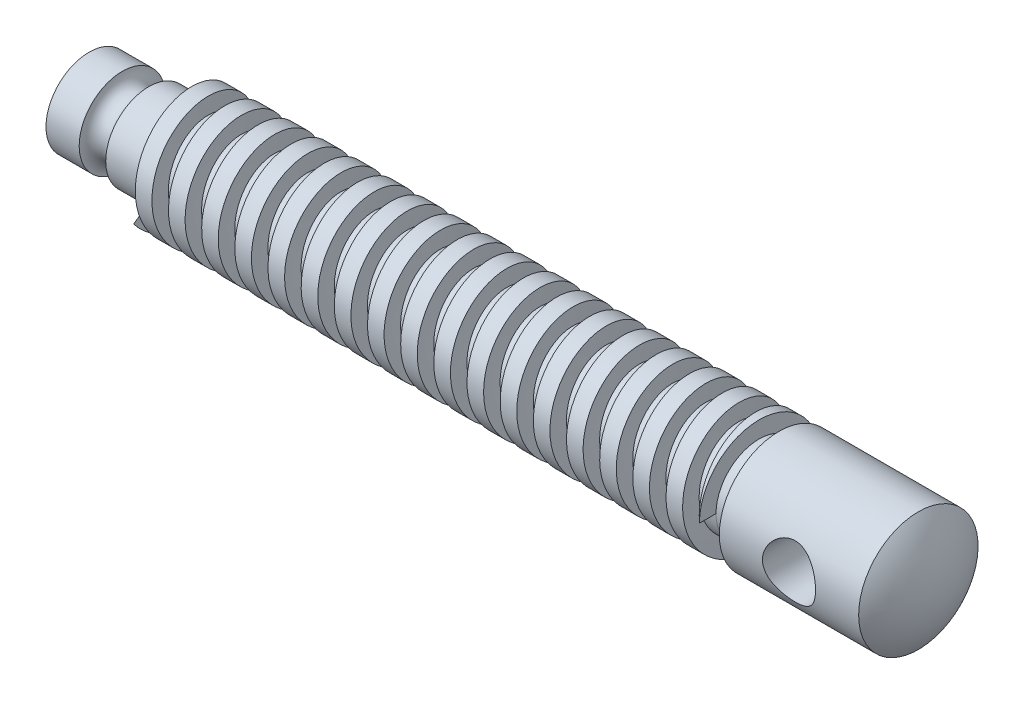
from build123d import *

# Parameters (mm, degrees)
CORTE_EXTRUS_O1_DEPTH      = 10
CORTE_EXTRUS_O1_DEPTH_BACK = 10
ESBO_O2_R                  = 4
VARREDURA_DE_CORTE1_PITCH  = 5
VARREDURA_DE_CORTE1_FROM   = 0


with BuildPart() as part:
    # Esboço1 → Revolução1 (revolve)
    with BuildSketch(Plane.XY, mode=Mode.PRIVATE) as revolu_o1_sk:
        with BuildLine():
            Line((-57.734372102, 0), (-53.734372102, 6.5))
            Line((-53.734372102, 6.5), (-48.734372102, 6.5))
            ThreePointArc((-48.734372102, 6.5), (-46.734372102, 4.5), (-44.734372102, 6.5))
            Line((-44.734372102, 6.5), (-39.734372102, 6.5))
            Line((-39.734372102, 6.5), (-39.734372102, 9))
            Line((-39.734372102, 9), (47.265627898, 9))
            Line((47.265627898, 9), (47.265627898, 6.5))
            Line((47.265627898, 6.5), (50.265627898, 6.5))
            Line((50.265627898, 6.5), (50.265627898, 9))
            Line((50.265627898, 9), (71.265627898, 9))
            ThreePointArc((71.265627898, 9), (73.495877369, 4.74341649), (74.265627898, 0))
            Line((74.265627898, 0), (-57.734372102, 0))
        make_face()
    revolve(revolu_o1_sk.sketch.rotate(Axis((-60.912149879, 0, 0), (1, 0, 0)), 90), axis=Axis((-60.912149879, 0, 0), (1, 0, 0)))

    # Esboço2 → Corte-extrusão1 (cut, two sides: drawn at the far end of the back side and taken through both)
    with BuildSketch(Plane.XY.offset(-CORTE_EXTRUS_O1_DEPTH_BACK)):
        with Locations(Location((60.765627898, 0, 0), (0, 0, 180))):
            Circle(ESBO_O2_R)
    extrude(amount=CORTE_EXTRUS_O1_DEPTH + CORTE_EXTRUS_O1_DEPTH_BACK, mode=Mode.SUBTRACT)

    # Varredura de corte1: arcs per turn and ends read off the stored shape
    # Varredura de corte1: the profile of Esboço4 profile screwed along a right-hand helix through 19 turns, 12 arcs to a turn; built about Z, then put on its axis
    varredura_de_corte1_z = Axis((0, 0, 0), (0, 0, 1))
    varredura_de_corte1_corners = [(9, 0, -5), (6.4997, 0, -5), (6.4997, 0, -2.5), (9, 0, -2.5)]
    with BuildLine(mode=Mode.PRIVATE) as varredura_de_corte1_profile:
        Line(varredura_de_corte1_corners[0], varredura_de_corte1_corners[1])
        Line(varredura_de_corte1_corners[1], varredura_de_corte1_corners[2])
        Line(varredura_de_corte1_corners[2], varredura_de_corte1_corners[3])
        Line(varredura_de_corte1_corners[3], varredura_de_corte1_corners[0])
    varredura_de_corte1_cap = Face(varredura_de_corte1_profile.wire())
    varredura_de_corte1_turn_angles = [0, 15, 30, 45, 60, 75, 90, 105, 120, 135, 150, 165, 180, 195, 210, 225, 240, 255, 270, 285, 300, 315, 330, 345, 360]
    varredura_de_corte1_turn_weights = [1, 0.9659258262890683, 1, 0.9659258262890683, 1, 0.9659258262890683, 1, 0.9659258262890683, 1, 0.9659258262890683, 1, 0.9659258262890683, 1, 0.9659258262890683, 1, 0.9659258262890683, 1, 0.9659258262890683, 1, 0.9659258262890683, 1, 0.9659258262890683, 1, 0.9659258262890683, 1]
    varredura_de_corte1_turn_rails = [Edge.make_bspline([Vector(p[0], p[1], 0).rotate(varredura_de_corte1_z, varredura_de_corte1_turn_angles[k]) / varredura_de_corte1_turn_weights[k] + Vector(0, 0, p[2] + VARREDURA_DE_CORTE1_PITCH * varredura_de_corte1_turn_angles[k] / 360) for k in range(25)], [0, 0, 0, 1, 1, 2, 2, 3, 3, 4, 4, 5, 5, 6, 6, 7, 7, 8, 8, 9, 9, 10, 10, 11, 11, 12, 12, 12], 2, varredura_de_corte1_turn_weights) for p in varredura_de_corte1_corners]
    varredura_de_corte1_turn_sides = [Face.make_surface_from_curves(varredura_de_corte1_turn_rails[p[0]], varredura_de_corte1_turn_rails[p[1]]) for p in [(0, 1), (1, 2), (2, 3), (3, 0)]]
    varredura_de_corte1 = Plane(origin=(47.265627898, 0, 0), x_dir=(0, 0, 1), z_dir=(-1, 0, 0)) * split(Solid(Shell([*[p.moved(Location((0, 0, VARREDURA_DE_CORTE1_PITCH * i))) for i in range(19) for p in varredura_de_corte1_turn_sides], varredura_de_corte1_cap, varredura_de_corte1_cap.rotate(varredura_de_corte1_z, 6840).moved(Location((0, 0, VARREDURA_DE_CORTE1_PITCH * 6840 / 360)))])), bisect_by=Plane.XY.offset(VARREDURA_DE_CORTE1_FROM), keep=Keep.TOP, mode=Mode.PRIVATE)
    add(varredura_de_corte1, mode=Mode.SUBTRACT)


solid = part.part
